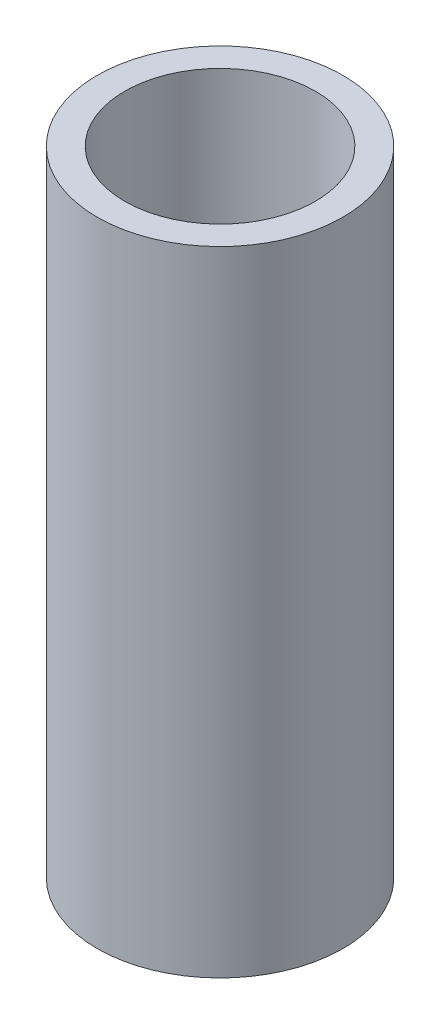
from build123d import *

# Parameters (mm, degrees)
SKETCH1_R           = 15
BOSS_EXTRUDE1_DEPTH = 77.332935661
SKETCH2_R           = 11.643103387
CUT_EXTRUDE1_DEPTH  = 81.189668524


with BuildPart() as part:
    # Sketch1 → Boss-Extrude1 (new body)
    with BuildSketch(Plane(origin=(0, 0, 0), x_dir=(1, 0, 0), z_dir=(0, 1, 0))):
        Circle(SKETCH1_R)
    extrude(amount=BOSS_EXTRUDE1_DEPTH)

    # Sketch2 → Cut-Extrude1 (cut, through all)
    with BuildSketch(Plane(origin=(0, 0, 0), x_dir=(1, 0, 0), z_dir=(0, 1, 0))):
        Circle(SKETCH2_R)
    extrude(amount=CUT_EXTRUDE1_DEPTH, mode=Mode.SUBTRACT)


solid = part.part
